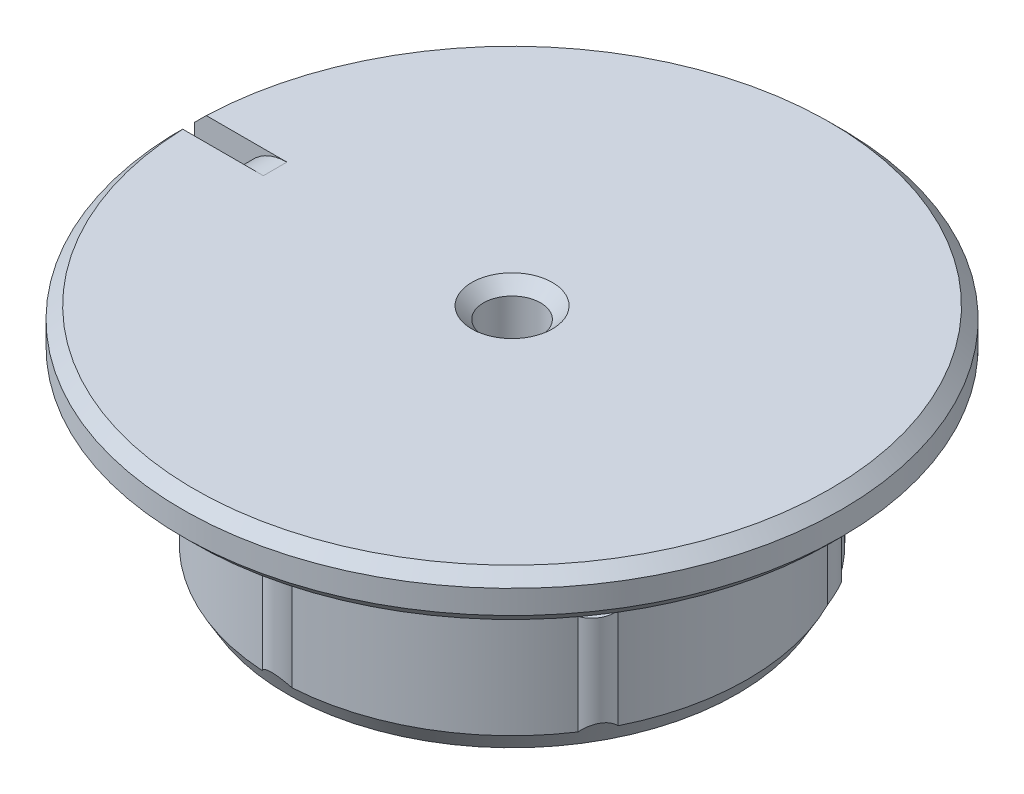
from build123d import *

# Parameters (mm, degrees)
BOSS_EXTRUDE1_START = -10
BOSS_EXTRUDE1_DEPTH = 10
CHAMFER1_SIZE       = 1
SKETCH4_W           = 3.87
SKETCH4_H           = 2
CUT_EXTRUDE1_DEPTH  = 44.920382512
FILLET1_R           = 4


with BuildPart() as part:
    # Sketch1 → Revolve1 (revolve)
    with BuildSketch(Plane.XY, mode=Mode.PRIVATE) as revolve1_sk:
        Polygon((0, 0), (20, 0), (20, 15), (28, 15), (28, 19), (2.425, 19), (2.425, 9), (0, 9), align=None)
    revolve(revolve1_sk.sketch.rotate(Axis((0, 0, 0), (0, 1, 0)), 90), axis=Axis((0, 0, 0), (0, 1, 0)))

    # Sketch2 → Boss-Extrude1 (add)
    with BuildSketch(Plane.XZ.offset(BOSS_EXTRUDE1_START)):
        with BuildLine():
            ThreePointArc((-1.25, 19.960899278), (0, 20.42), (1.25, 19.960899278))
            ThreePointArc((1.25, 19.960899278), (10, 17.320508076), (16.661645857, 11.062981394))
            ThreePointArc((16.661645857, 11.062981394), (17.684238745, 10.21), (17.911645857, 8.897917884))
            ThreePointArc((17.911645857, 8.897917884), (20, 0), (17.911645857, -8.897917884))
            ThreePointArc((17.911645857, -8.897917884), (17.684238745, -10.21), (16.661645857, -11.062981394))
            ThreePointArc((16.661645857, -11.062981394), (10, -17.320508076), (1.25, -19.960899278))
            ThreePointArc((1.25, -19.960899278), (0, -20.42), (-1.25, -19.960899278))
            ThreePointArc((-1.25, -19.960899278), (-10, -17.320508076), (-16.661645857, -11.062981394))
            ThreePointArc((-16.661645857, -11.062981394), (-17.684238745, -10.21), (-17.911645857, -8.897917884))
            ThreePointArc((-17.911645857, -8.897917884), (-20, 0), (-17.911645857, 8.897917884))
            ThreePointArc((-17.911645857, 8.897917884), (-17.684238745, 10.21), (-16.661645857, 11.062981394))
            ThreePointArc((-16.661645857, 11.062981394), (-10, 17.320508076), (-1.25, 19.960899278))
        make_face()
    extrude(amount=BOSS_EXTRUDE1_DEPTH)

    # Sketch3 → Cut-Revolve1 (revolve, cut)
    with BuildSketch(Plane.XY, mode=Mode.PRIVATE) as cut_revolve1_sk:
        Polygon((-21, 3.232050808), (-18.556624327, -1), (-21, -1), align=None)
    revolve(cut_revolve1_sk.sketch.rotate(Axis((0, 29.336873575, 0), (0, -1, 0)), 273.58332148), axis=Axis((0, 29.336873575, 0), (0, -1, 0)), mode=Mode.SUBTRACT)

    # Chamfer1
    chamfer1_edges = [part.edges().sort_by_distance(p)[0] for p in [
        (0, 19, 2.425),
        (0, 19, 28),
        (0, 15, 28),
    ]]
    chamfer(chamfer1_edges, length=CHAMFER1_SIZE)

    # Sketch4 → Cut-Extrude1 (cut, through all)
    with BuildSketch(Plane.XZ):
        with Locations((-26.065, 0)):
            Rectangle(SKETCH4_W, SKETCH4_H)
    extrude(amount=-CUT_EXTRUDE1_DEPTH, mode=Mode.SUBTRACT)

    # Fillet1
    fillet1_edges = [part.edges().sort_by_distance(p)[0] for p in [
        (-24.13, 19, 0),
    ]]
    fillet(fillet1_edges, radius=FILLET1_R - 0.0001)  # a hair under: the kernel refuses the full size


solid = part.part
